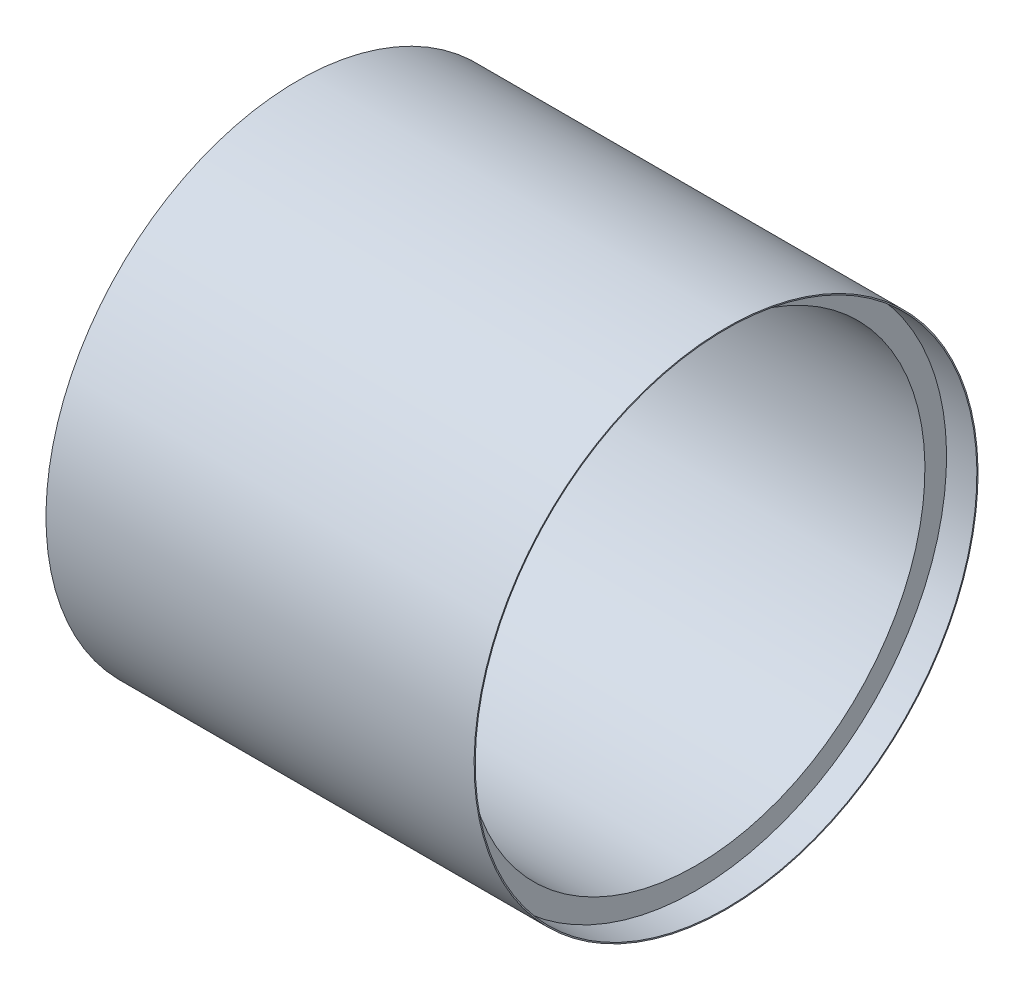
from build123d import *


with BuildPart() as part:
    # Sketch1 → Revolve1 (revolve)
    with BuildSketch(Plane.XY):
        Polygon((39.146309032, 84.3534), (39.146309032, 83.9724), (49.306309032, 83.9724), (49.306309032, 76.7334), (172.318509032, 76.7334), (172.318509032, 83.9724), (182.478509032, 83.9724), (182.478509032, 84.3534), align=None)
    revolve(axis=Axis((0, 0, 0), (1, 0, 0)))


solid = part.part
